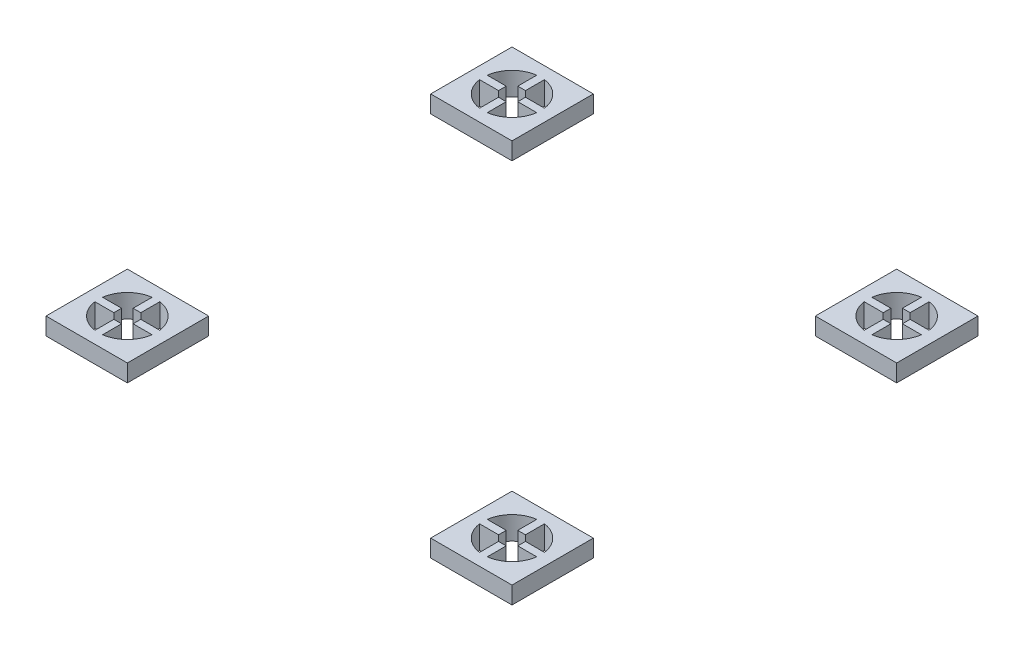
from build123d import *

# Parameters (mm, degrees)
SKETCH2_W             = 211.424938922
SKETCH2_H             = 211.424938922
BOSS_EXTRUDE1_DEPTH   = 60
BOSS_EXTRUDE1_2_DEPTH = 60
BOSS_EXTRUDE1_3_DEPTH = 60
BOSS_EXTRUDE1_4_DEPTH = 60
CHAMFER1_SIZE         = 15
CHAMFER2_SIZE         = 15
CHAMFER3_SIZE         = 15
CHAMFER4_SIZE         = 15


with BuildPart() as part:
    # Sketch2 → Boss-Extrude1 (new body)
    with BuildSketch(Plane(origin=(0, 0, 0), x_dir=(1, 0, 0), z_dir=(0, 1, 0))):
        with Locations((500, -500)):
            Rectangle(SKETCH2_W, SKETCH2_H)
        with BuildLine():
            Line((510, -475), (510, -425.669656263))
            ThreePointArc((510, -425.669656263), (553.033008589, -446.966991411), (574.330343737, -490))
            Line((574.330343737, -490), (525, -490))
            Line((525, -490), (525, -510))
            Line((525, -510), (574.330343737, -510))
            ThreePointArc((574.330343737, -510), (553.033008589, -553.033008589), (510, -574.330343737))
            Line((510, -574.330343737), (510, -525))
            Line((510, -525), (490, -525))
            Line((490, -525), (490, -574.330343737))
            ThreePointArc((490, -574.330343737), (446.966991411, -553.033008589), (425.669656263, -510))
            Line((425.669656263, -510), (475, -510))
            Line((475, -510), (475, -490))
            Line((475, -490), (425.669656263, -490))
            ThreePointArc((425.669656263, -490), (446.966991411, -446.966991411), (490, -425.669656263))
            Line((490, -425.669656263), (490, -475))
            Line((490, -475), (510, -475))
        make_face(mode=Mode.SUBTRACT)
    extrude(amount=BOSS_EXTRUDE1_DEPTH)

    # Chamfer3
    chamfer3_edges = [part.edges().sort_by_distance(p)[0] for p in [
        (605.712469461, 0, 500),
        (500, 0, 605.712469461),
        (394.287530539, 0, 500),
        (500, 0, 394.287530539),
    ]]
    chamfer(chamfer3_edges, length=CHAMFER3_SIZE)


with BuildPart() as body_2:
    # Sketch2 → Boss-Extrude1 2 (new body)
    with BuildSketch(Plane(origin=(0, 0, 0), x_dir=(1, 0, 0), z_dir=(0, 1, 0))):
        with Locations((-500, -500)):
            Rectangle(SKETCH2_W, SKETCH2_H)
        with BuildLine():
            Line((-490, -475), (-490, -425.669656263))
            ThreePointArc((-490, -425.669656263), (-446.966991411, -446.966991411), (-425.669656263, -490))
            Line((-425.669656263, -490), (-475, -490))
            Line((-475, -490), (-475, -510))
            Line((-475, -510), (-425.669656263, -510))
            ThreePointArc((-425.669656263, -510), (-446.966991411, -553.033008589), (-490, -574.330343737))
            Line((-490, -574.330343737), (-490, -525))
            Line((-490, -525), (-510, -525))
            Line((-510, -525), (-510, -574.330343737))
            ThreePointArc((-510, -574.330343737), (-553.033008589, -553.033008589), (-574.330343737, -510))
            Line((-574.330343737, -510), (-525, -510))
            Line((-525, -510), (-525, -490))
            Line((-525, -490), (-574.330343737, -490))
            ThreePointArc((-574.330343737, -490), (-553.033008589, -446.966991411), (-510, -425.669656263))
            Line((-510, -425.669656263), (-510, -475))
            Line((-510, -475), (-490, -475))
        make_face(mode=Mode.SUBTRACT)
    extrude(amount=BOSS_EXTRUDE1_2_DEPTH)

    # Chamfer4
    chamfer4_edges = [body_2.edges().sort_by_distance(p)[0] for p in [
        (-605.712469461, 0, 500),
        (-500, 0, 605.712469461),
        (-394.287530539, 0, 500),
        (-500, 0, 394.287530539),
    ]]
    chamfer(chamfer4_edges, length=CHAMFER4_SIZE)


with BuildPart() as body_3:
    # Sketch2 → Boss-Extrude1 3 (new body)
    with BuildSketch(Plane(origin=(0, 0, 0), x_dir=(1, 0, 0), z_dir=(0, 1, 0))):
        with Locations((500, 500)):
            Rectangle(SKETCH2_W, SKETCH2_H)
        with BuildLine():
            Line((510, 525), (510, 574.330343737))
            ThreePointArc((510, 574.330343737), (553.033008589, 553.033008589), (574.330343737, 510))
            Line((574.330343737, 510), (525, 510))
            Line((525, 510), (525, 490))
            Line((525, 490), (574.330343737, 490))
            ThreePointArc((574.330343737, 490), (553.033008589, 446.966991411), (510, 425.669656263))
            Line((510, 425.669656263), (510, 475))
            Line((510, 475), (490, 475))
            Line((490, 475), (490, 425.669656263))
            ThreePointArc((490, 425.669656263), (446.966991411, 446.966991411), (425.669656263, 490))
            Line((425.669656263, 490), (475, 490))
            Line((475, 490), (475, 510))
            Line((475, 510), (425.669656263, 510))
            ThreePointArc((425.669656263, 510), (446.966991411, 553.033008589), (490, 574.330343737))
            Line((490, 574.330343737), (490, 525))
            Line((490, 525), (510, 525))
        make_face(mode=Mode.SUBTRACT)
    extrude(amount=BOSS_EXTRUDE1_3_DEPTH)

    # Chamfer2
    chamfer2_edges = [body_3.edges().sort_by_distance(p)[0] for p in [
        (605.712469461, 0, -500),
        (500, 0, -394.287530539),
        (394.287530539, 0, -500),
        (500, 0, -605.712469461),
    ]]
    chamfer(chamfer2_edges, length=CHAMFER2_SIZE)


with BuildPart() as body_4:
    # Sketch2 → Boss-Extrude1 4 (new body)
    with BuildSketch(Plane(origin=(0, 0, 0), x_dir=(1, 0, 0), z_dir=(0, 1, 0))):
        with Locations((-500, 500)):
            Rectangle(SKETCH2_W, SKETCH2_H)
        with BuildLine():
            Line((-490, 525), (-490, 574.330343737))
            ThreePointArc((-490, 574.330343737), (-446.966991411, 553.033008589), (-425.669656263, 510))
            Line((-425.669656263, 510), (-475, 510))
            Line((-475, 510), (-475, 490))
            Line((-475, 490), (-425.669656263, 490))
            ThreePointArc((-425.669656263, 490), (-446.966991411, 446.966991411), (-490, 425.669656263))
            Line((-490, 425.669656263), (-490, 475))
            Line((-490, 475), (-510, 475))
            Line((-510, 475), (-510, 425.669656263))
            ThreePointArc((-510, 425.669656263), (-553.033008589, 446.966991411), (-574.330343737, 490))
            Line((-574.330343737, 490), (-525, 490))
            Line((-525, 490), (-525, 510))
            Line((-525, 510), (-574.330343737, 510))
            ThreePointArc((-574.330343737, 510), (-553.033008589, 553.033008589), (-510, 574.330343737))
            Line((-510, 574.330343737), (-510, 525))
            Line((-510, 525), (-490, 525))
        make_face(mode=Mode.SUBTRACT)
    extrude(amount=BOSS_EXTRUDE1_4_DEPTH)

    # Chamfer1
    chamfer1_edges = [body_4.edges().sort_by_distance(p)[0] for p in [
        (-500, 0, -605.712469461),
        (-394.287530539, 0, -500),
        (-500, 0, -394.287530539),
        (-605.712469461, 0, -500),
    ]]
    chamfer(chamfer1_edges, length=CHAMFER1_SIZE)


solid = Compound([part.part, body_2.part, body_3.part, body_4.part])
